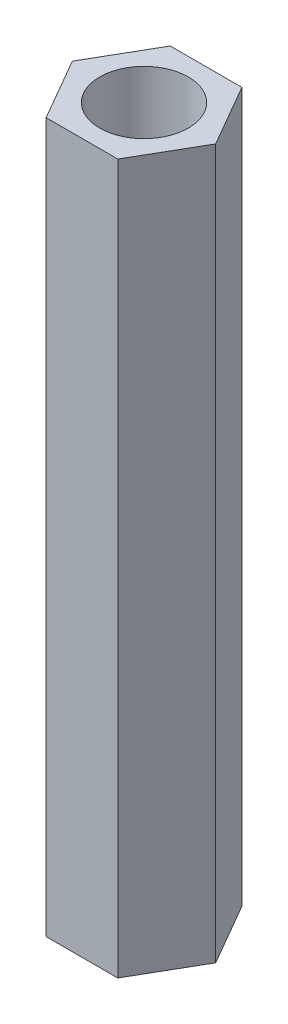
from build123d import *

# Parameters (mm, degrees)
SKETCH_1_R      = 2.5
EXTRUDE_1_DEPTH = 40


with BuildPart() as part:
    # 草图1 → 凸台-拉伸1 (new body)
    with BuildSketch(Plane(origin=(0, 0, 0), x_dir=(1, 0, 0), z_dir=(0, 1, 0))):
        Polygon((2.020725942, 3.5), (-2.020725942, 3.5), (-4.041451884, 0), (-2.020725942, -3.5), (2.020725942, -3.5), (4.041451884, 0), align=None)
        Circle(SKETCH_1_R, mode=Mode.SUBTRACT)
    extrude(amount=EXTRUDE_1_DEPTH)


solid = part.part
